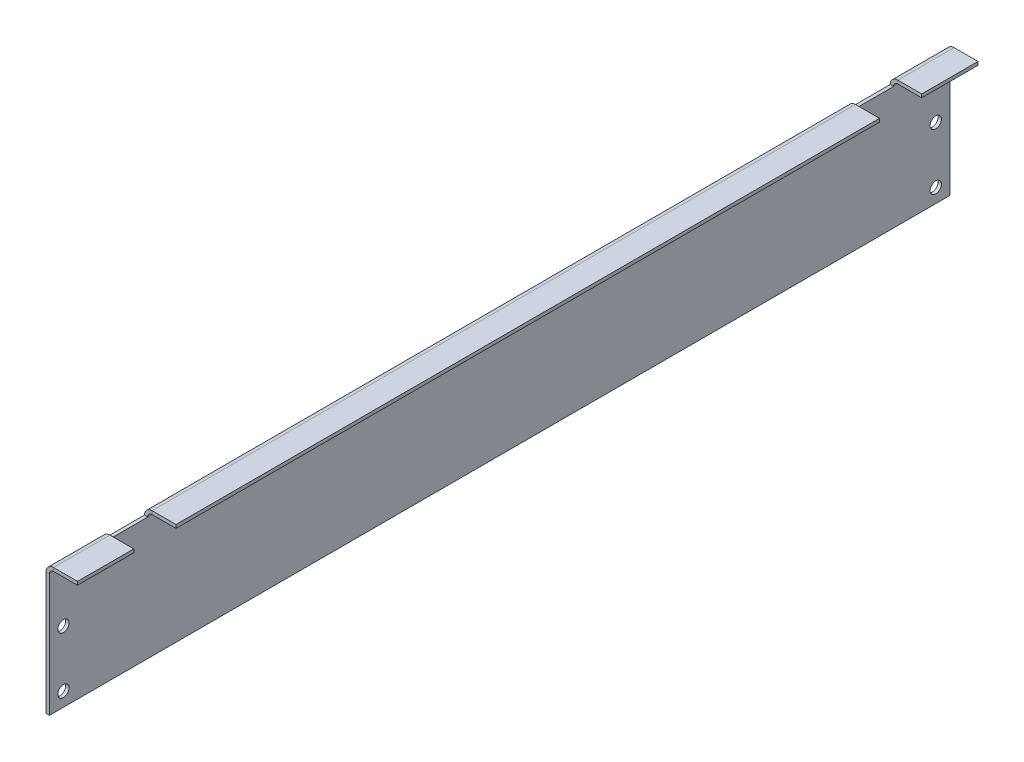
from build123d import *

# Parameters (mm, degrees)
SKETCH1_W                    = 406.4
SKETCH1_H                    = 58.7375
BASE_FLANGE1_DEPTH           = 1.51892
EDGE_FLANGE1_STRIP_W         = 9.88568
EDGE_FLANGE1_STRIP_H         = 1.51892
EDGE_FLANGE1_STRIP_CUT_DEPTH = 406.4
EDGE_FLANGE1_DEPTH           = 406.4
SKETCH10_W                   = 19.05
SKETCH10_H                   = 3.42392
CUT_EXTRUDE2_DEPTH           = 206.803161206
F_10_CLEARANCE_HOLE1_D       = 5.1054


# Sheet-metal steps are written as plain solids
with BuildPart() as part:
    # Sketch1 → Base-Flange1 (new body)
    with BuildSketch(Plane(origin=(0, 0, 0), x_dir=(0, 0, -1), z_dir=(1, 0, 0))):
        Rectangle(SKETCH1_W, SKETCH1_H)
    extrude(amount=-BASE_FLANGE1_DEPTH)

    # Edge-Flange1 strip (across the edge) → Edge-Flange1 strip cut (cut)
    with BuildSketch(Plane(origin=(0, 29.36875, -203.2), x_dir=(0, -1, 0), z_dir=(0, 0, 1))):
        with Locations((-1.51892, -0.75946)):
            Rectangle(EDGE_FLANGE1_STRIP_W, EDGE_FLANGE1_STRIP_H)
    extrude(amount=EDGE_FLANGE1_STRIP_CUT_DEPTH, mode=Mode.SUBTRACT)

    # Edge-Flange1 section (across the edge) → Edge-Flange1 (add)
    with BuildSketch(Plane(origin=(0, 29.36875, -203.2), x_dir=(0, -1, 0), z_dir=(0, 0, 1))):
        with BuildLine():
            Line((0, 1.905), (0, 12.7))
            Line((0, 12.7), (1.51892, 12.7))
            Line((1.51892, 12.7), (1.51892, 1.905))
            ThreePointArc((1.51892, 1.905), (2.076881582, 0.557961582), (3.42392, 0))
            Line((3.42392, 0), (3.42392, -1.51892))
            ThreePointArc((3.42392, -1.51892), (1.00284295, -0.51607705), (0, 1.905))
        make_face()
    extrude(amount=EDGE_FLANGE1_DEPTH)

    # Sketch10 → Cut-Extrude2 (cut, through all)
    with BuildSketch(Plane.ZY.offset(1.51892)):
        with Locations((-168.275, 27.65679)):
            Rectangle(SKETCH10_W, SKETCH10_H)
        with Locations((168.275, 27.65679)):
            Rectangle(SKETCH10_W, SKETCH10_H)
    extrude(amount=-CUT_EXTRUDE2_DEPTH, mode=Mode.SUBTRACT)

    # #10 Clearance Hole1 (through all)
    with Locations(Plane(origin=(0, 0, 0), x_dir=(0, 0, -1), z_dir=(1, 0, 0))):
        with Locations((-196.85, 2.38125), (196.85, -23.01875), (-196.85, -23.01875), (196.85, 2.38125)):
            Hole(F_10_CLEARANCE_HOLE1_D / 2)


solid = part.part
